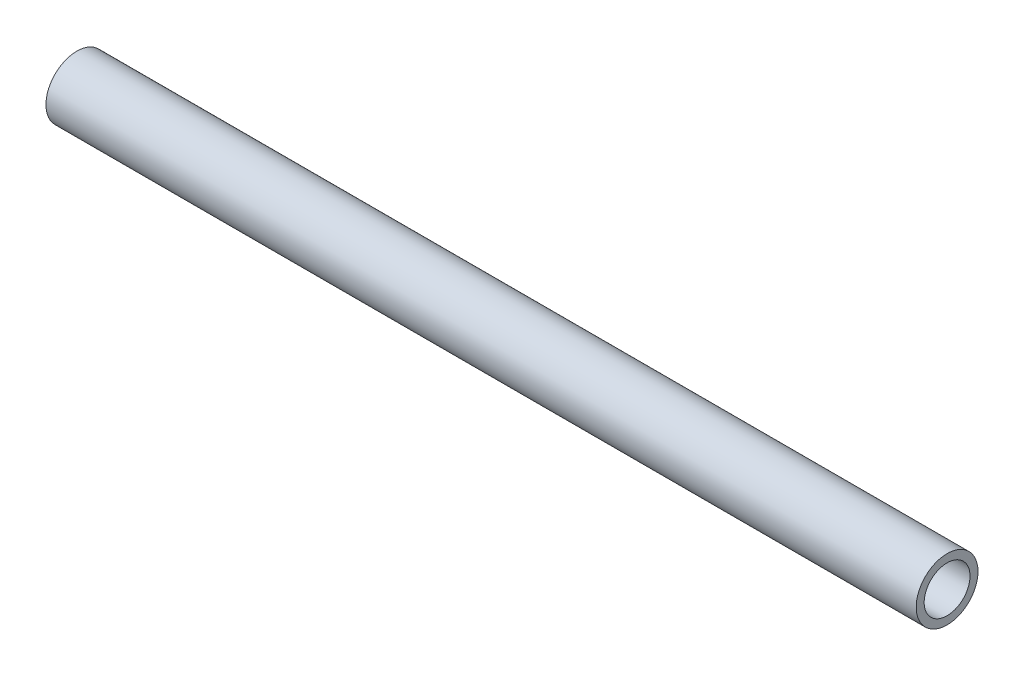
from build123d import *

# Parameters (mm, degrees)
CROQUIS1_R              = 10.65
CROQUIS1_R_2            = 7.9
SALIENTE_EXTRUIR1_DEPTH = 300


with BuildPart() as part:
    # Croquis1 → Saliente-Extruir1 (new body)
    with BuildSketch(Plane(origin=(0, 0, 0), x_dir=(0, 0, -1), z_dir=(1, 0, 0))):
        Circle(CROQUIS1_R)
        Circle(CROQUIS1_R_2, mode=Mode.SUBTRACT)
    extrude(amount=SALIENTE_EXTRUIR1_DEPTH)


solid = part.part
